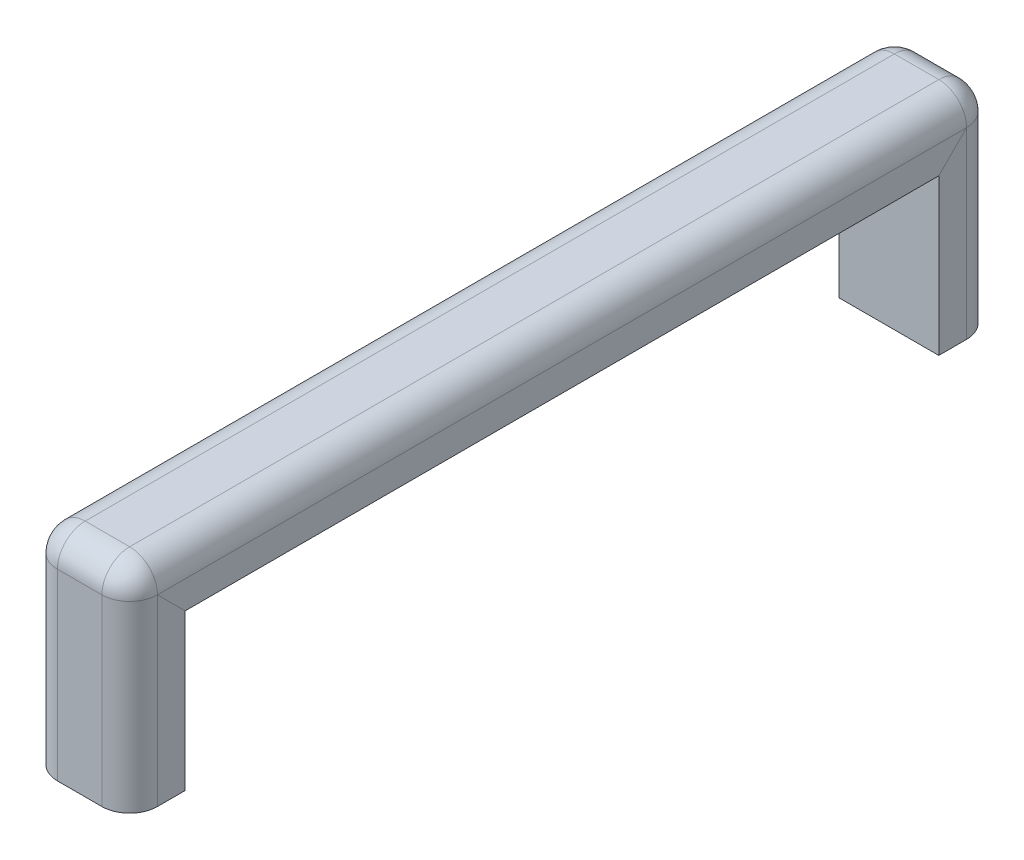
from build123d import *

# Parameters (mm, degrees)
FILLET1_R = 31.75


with BuildPart() as part:
    # Sweep2: sweep along a path in Sketch1
    with BuildLine(Plane(origin=(0, 0, 0), x_dir=(0, 0, -1), z_dir=(1, 0, 0))) as sweep2_path:
        Line((-430.75225, -177.8635), (-430.75225, 0))
        Line((-430.75225, 0), (430.75225, 0))
        Line((430.75225, 0), (430.75225, -177.8635))
    # Sketch2 → Sweep2 (sweep)
    with BuildSketch(Plane(origin=(0, 0, 0), x_dir=(1, 0, 0), z_dir=(0, 1, 0))):
        with BuildLine():
            Line((0, -430.75225), (114.3, -430.75225))
            Line((114.3, -430.75225), (114.3, -462.50225))
            ThreePointArc((114.3, -462.50225), (105.000640303, -484.952890303), (82.55, -494.25225))
            Line((82.55, -494.25225), (31.75, -494.25225))
            ThreePointArc((31.75, -494.25225), (9.299359697, -484.952890303), (0, -462.50225))
            Line((0, -462.50225), (0, -430.75225))
        make_face()
    sweep(path=sweep2_path.line, transition=Transition.RIGHT)

    # Fillet1
    # the kernel refuses this fillet: 31.75 mm, written as the material it takes off along each edge
    with BuildSketch(Plane(origin=(82.55, 31.75, -462.50225), x_dir=(0, 0, -1), z_dir=(0, 1, 0))) as fillet1_piece_1_section:
        Polygon((0, 0), (FILLET1_R * 1.02, 0), (FILLET1_R * 1.02, -FILLET1_R * 1.02), (0, -FILLET1_R * 1.02), align=None)
    fillet1_piece_1 = extrude(amount=FILLET1_R * 1.02, mode=Mode.PRIVATE)
    fillet1_piece_1 = fillet1_piece_1 - Plane(origin=(82.55, 31.75, -462.50225), x_dir=(-0.7071067811865477, 0, 0.7071067811865474), z_dir=(0, 1, 0)) * Sphere(FILLET1_R, mode=Mode.PRIVATE)
    add(fillet1_piece_1, mode=Mode.SUBTRACT)
    with BuildSketch(Plane(origin=(31.75, 31.75, -462.50225), x_dir=(0, 0, -1), z_dir=(0, 1, 0))) as fillet1_piece_2_section:
        Polygon((0, 0), (FILLET1_R * 1.02, 0), (FILLET1_R * 1.02, FILLET1_R * 1.02), (0, FILLET1_R * 1.02), align=None)
    fillet1_piece_2 = extrude(amount=FILLET1_R * 1.02, mode=Mode.PRIVATE)
    fillet1_piece_2 = fillet1_piece_2 - Plane(origin=(31.75, 31.75, -462.50225), x_dir=(0.7071067811865475, 0, 0.7071067811865475), z_dir=(0, 1, 0)) * Sphere(FILLET1_R, mode=Mode.PRIVATE)
    add(fillet1_piece_2, mode=Mode.SUBTRACT)
    with BuildSketch(Plane(origin=(31.75, 31.75, 462.50225), x_dir=(0, 1, 0), z_dir=(0, 0, 1))) as fillet1_piece_3_section:
        Polygon((0, 0), (FILLET1_R * 1.02, 0), (FILLET1_R * 1.02, FILLET1_R * 1.02), (0, FILLET1_R * 1.02), align=None)
    fillet1_piece_3 = extrude(amount=FILLET1_R * 1.02, mode=Mode.PRIVATE)
    fillet1_piece_3 = fillet1_piece_3 - Plane(origin=(31.75, 31.75, 462.50225), x_dir=(0.7071067811865477, -0.7071067811865475, 0), z_dir=(0, 0, 1)) * Sphere(FILLET1_R, mode=Mode.PRIVATE)
    add(fillet1_piece_3, mode=Mode.SUBTRACT)
    with BuildSketch(Plane(origin=(82.55, 31.75, 462.50225), x_dir=(0, 1, 0), z_dir=(0, 0, 1))) as fillet1_piece_4_section:
        Polygon((0, 0), (FILLET1_R * 1.02, 0), (FILLET1_R * 1.02, -FILLET1_R * 1.02), (0, -FILLET1_R * 1.02), align=None)
    fillet1_piece_4 = extrude(amount=FILLET1_R * 1.02, mode=Mode.PRIVATE)
    fillet1_piece_4 = fillet1_piece_4 - Plane(origin=(82.55, 31.75, 462.50225), x_dir=(-0.7071067811865475, -0.7071067811865476, 0), z_dir=(0, 0, 1)) * Sphere(FILLET1_R, mode=Mode.PRIVATE)
    add(fillet1_piece_4, mode=Mode.SUBTRACT)
    with BuildSketch(Plane(origin=(82.55, 63.5, -494.25225), x_dir=(0, 0, 1), z_dir=(-1, 0, 0)), Plane(origin=(82.55, 63.5, 494.25225), x_dir=(0, -1, 0), z_dir=(-1, 0, 0))) as fillet1_piece_5:
        with BuildLine():
            CenterArc((FILLET1_R, -FILLET1_R), FILLET1_R, 90, 90)
            Line((0, -FILLET1_R), (0, 0))
            Line((0, 0), (FILLET1_R, 0))
        make_face()
    extrude(amount=50.8, mode=Mode.SUBTRACT)


solid = part.part
